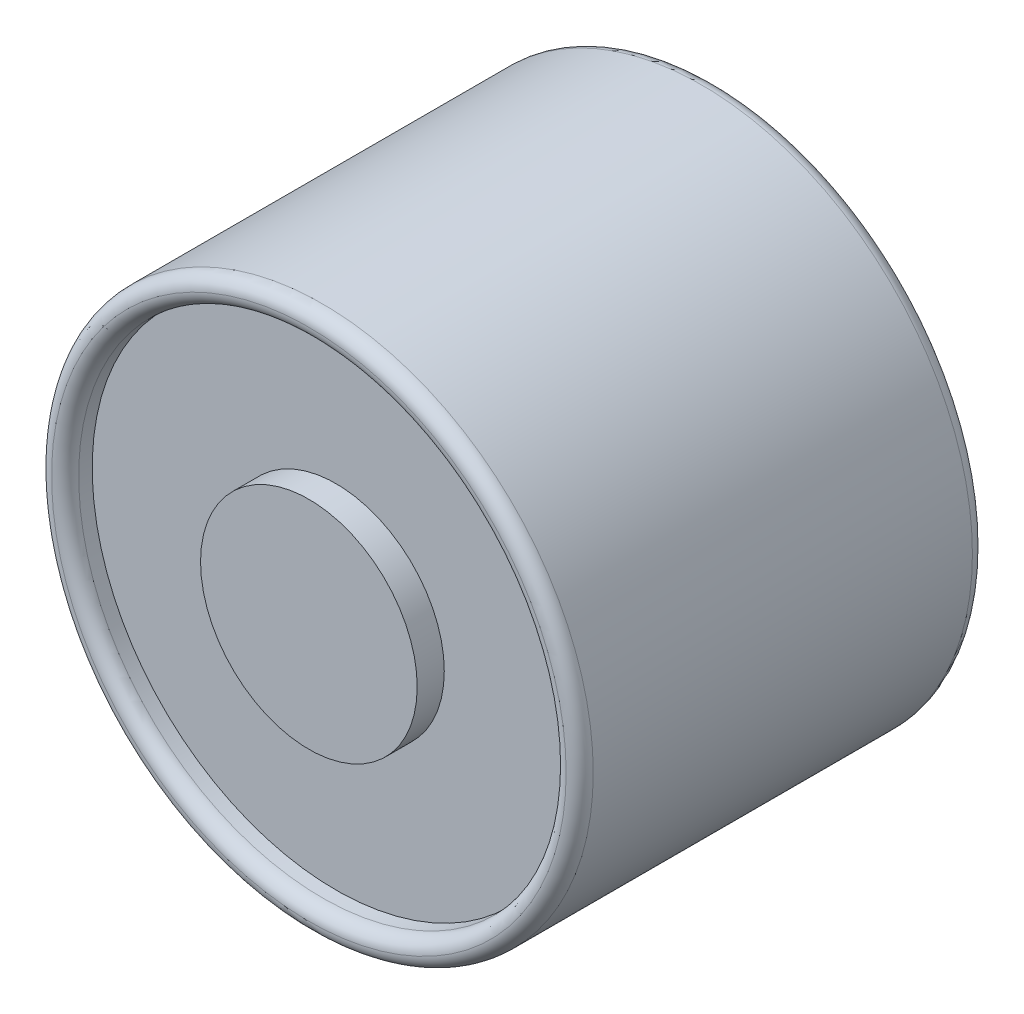
from build123d import *

# Parameters (mm, degrees)
SKETCH_1_R          = 10
EXTRUDE_1_DEPTH     = 15
SKETCH_2_R          = 9
SKETCH_2_R_2        = 4
CUT_EXTRUDE_1_DEPTH = 1
FILLET_1_R          = 0.5
SKETCH_3_R          = 2
CUT_EXTRUDE_2_DEPTH = 8


with BuildPart() as part:
    # 草图1 → 凸台-拉伸1 (new body)
    with BuildSketch(Plane.XY):
        Circle(SKETCH_1_R)
    extrude(amount=EXTRUDE_1_DEPTH)

    # 草图2 → 切除-拉伸1 (cut)
    with BuildSketch(Plane.XY.offset(15)):
        Circle(SKETCH_2_R)
        Circle(SKETCH_2_R_2, mode=Mode.SUBTRACT)
    extrude(amount=-CUT_EXTRUDE_1_DEPTH, mode=Mode.SUBTRACT)

    # 圆角1
    fillet_1_edges = [part.edges().sort_by_distance(p)[0] for p in [
        (-10, 0, 0),
        (-10, 0, 15),
        (-9, 0, 15),
    ]]
    fillet(fillet_1_edges, radius=FILLET_1_R - 0.0001)  # a hair under: the kernel refuses the full size

    # 草图3 → 切除-拉伸2 (cut)
    with BuildSketch(Plane(origin=(0, 0, 0), x_dir=(-1, 0, 0), z_dir=(0, 0, -1))):
        Circle(SKETCH_3_R)
    extrude(amount=-CUT_EXTRUDE_2_DEPTH, mode=Mode.SUBTRACT)


solid = part.part
